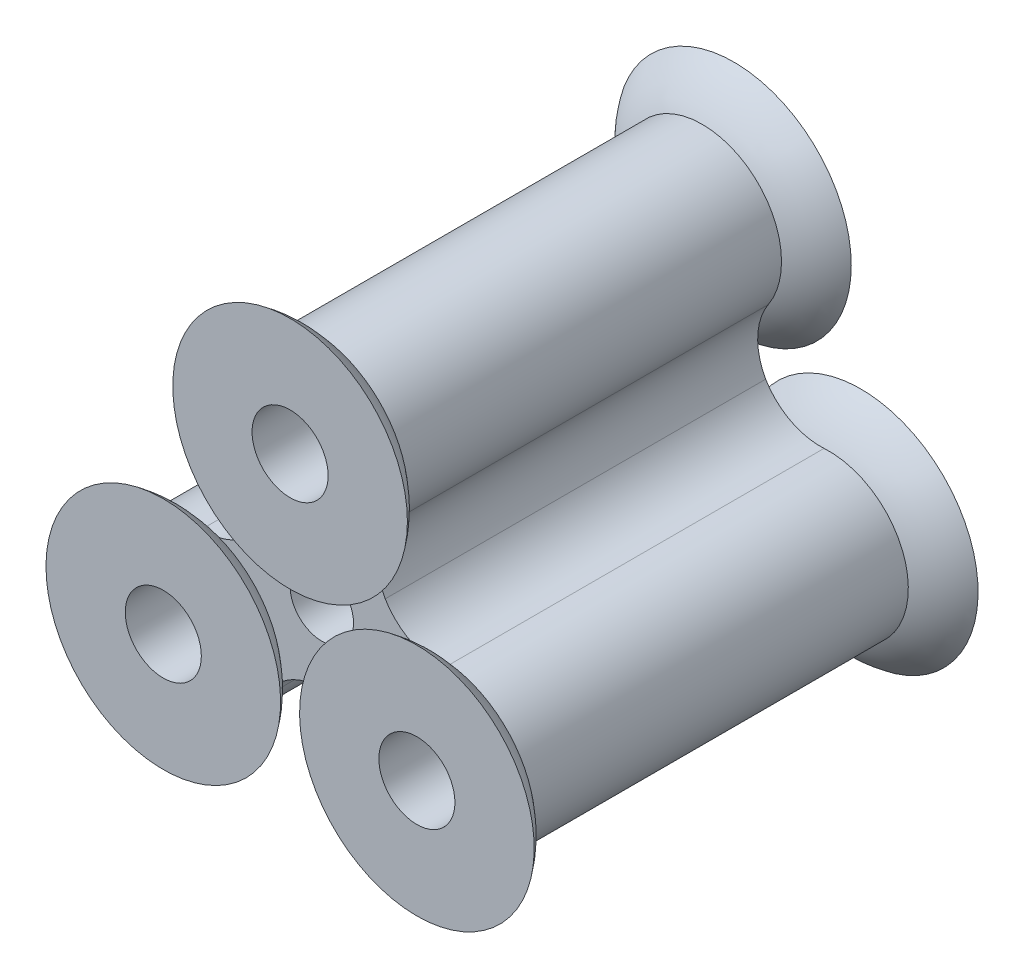
from build123d import *
from build123d.topology import SkipClean

# Parameters (mm, degrees)
SKETCH1_R           = 6
SKETCH1_R_2         = 5
BOSS_EXTRUDE1_DEPTH = 60
FILLET1_R           = 10
FILLET2_R           = 9
CIRPATTERN1_COUNT   = 3


with BuildPart() as part:
    # Sketch1 → Boss-Extrude1 (new body)
    with BuildSketch(Plane.XY):
        with BuildLine():
            ThreePointArc((7.496526573, -11.545), (30.821844121, -17.795), (13.746526573, -0.719682453))
            Line((13.746526573, -0.719682453), (6.25, 12.264682453))
            ThreePointArc((6.25, 12.264682453), (0, 35.59), (-6.25, 12.264682453))
            Line((-6.25, 12.264682453), (-13.746526573, -0.719682453))
            ThreePointArc((-13.746526573, -0.719682453), (-30.821844121, -17.795), (-7.496526573, -11.545))
            Line((-7.496526573, -11.545), (7.496526573, -11.545))
        make_face()
        with Locations((19.996526573, -11.545)):
            Circle(SKETCH1_R, mode=Mode.SUBTRACT)
        with Locations((0, 23.09)):
            Circle(SKETCH1_R, mode=Mode.SUBTRACT)
        Circle(SKETCH1_R_2, mode=Mode.SUBTRACT)
        with Locations((-19.996526573, -11.545)):
            Circle(SKETCH1_R, mode=Mode.SUBTRACT)
    extrude(amount=BOSS_EXTRUDE1_DEPTH)

    # Fillet1
    # the kernel refuses this fillet: 10 mm, written as the material it adds along each edge
    with BuildSketch(Plane(origin=(13.746526573, -0.719682453, 0), x_dir=(0.9572887202141619, 0.28913371673108657, 0), z_dir=(0, 0, 1))) as fillet1_piece_1:
        with BuildLine():
            CenterArc((7.988652571, 9.736032088), FILLET1_R, 193.193899981, 63.612200039)
            Line((-1.747379517, 7.453559925), (0, 0))
            ThreePointArc((0, 0), (2.853090204, 0.32995989), (5.706180408, 0))
        make_face()
    extrude(amount=60)
    with BuildSketch(Plane(origin=(6.25, 12.264682453, 0), x_dir=(0.4999999999999975, -0.86602540378444, 0), z_dir=(0, 0, 1))) as fillet1_piece_2:
        with BuildLine():
            CenterArc((7.655644371, 10), FILLET1_R, 206.387799961, 63.612200039)
            ThreePointArc((-1.302419794, 5.555555556), (-0.32995989, 2.853090204), (0, 0))
            Line((0, 0), (7.655644371, 0))
        make_face()
    extrude(amount=60)

    # Fillet2
    fillet2_edges = [part.edges().sort_by_distance(p)[0] for p in [
        (7.496526573, -11.545, 30),
        (-7.496526573, -11.545, 30),
        (-13.746526573, -0.719682453, 30),
        (-6.25, 12.264682453, 30),
    ]]
    fillet(fillet2_edges, radius=FILLET2_R)

    # Sketch2 → Revolve3 (revolve)
    with BuildSketch(Plane(origin=(0, 0, 0), x_dir=(0, 0, -1), z_dir=(1, 0, 0)), mode=Mode.PRIVATE) as revolve3_sk:
        with BuildLine():
            Line((-60, 35.59), (-60, 29.09))
            Line((-60, 29.09), (-65, 29.09))
            Line((-65, 29.09), (-65, 41.59))
            ThreePointArc((-65, 41.59), (-62.102636282, 38.921136432), (-60, 35.59))
        make_face()
    revolve3 = revolve(revolve3_sk.sketch.rotate(Axis((0, 23.09, 60), (0, 0, -1)), 90), axis=Axis((0, 23.09, 60), (0, 0, -1)))

    # CirPattern1: Revolve3 ×3 about axis
    with SkipClean():  # the faces are left unmerged after this step: merging them gives an invalid solid
        cirpattern1_axis = Axis((0, 0, 0), (0, 0, 1))
        for i in range(1, CIRPATTERN1_COUNT):
            add(revolve3.rotate(cirpattern1_axis, i * 360 / CIRPATTERN1_COUNT))

    # Mirror1: Revolve3 across plane
    with SkipClean():  # the faces are left unmerged after this step: merging them gives an invalid solid
        add(revolve3.mirror(Plane.XY.offset(30)))

    # Mirror1 copy 1 sketch → Mirror1 copy 1 (revolve)
    with SkipClean():  # the faces are left unmerged after this step: merging them gives an invalid solid
        with BuildSketch(Plane(origin=(0, 0, 60), x_dir=(0, 0, 1), z_dir=(-0.4999999999999998, 0.8660254037844387, 0))):
            with BuildLine():
                Line((-60, -35.59), (-60, -29.09))
                Line((-60, -29.09), (-65, -29.09))
                Line((-65, -29.09), (-65, -41.59))
                ThreePointArc((-65, -41.59), (-62.102636282, -38.921136432), (-60, -35.59))
            make_face()
        revolve(axis=Axis((-19.996526573, -11.545, 0), (0, 0, -1)))

    # Mirror1 copy 2 sketch → Mirror1 copy 2 (revolve)
    with SkipClean():  # the faces are left unmerged after this step: merging them gives an invalid solid
        with BuildSketch(Plane(origin=(0, 0, 60), x_dir=(0, 0, 1), z_dir=(-0.5000000000000004, -0.8660254037844384, 0))):
            with BuildLine():
                Line((-60, -35.59), (-60, -29.09))
                Line((-60, -29.09), (-65, -29.09))
                Line((-65, -29.09), (-65, -41.59))
                ThreePointArc((-65, -41.59), (-62.102636282, -38.921136432), (-60, -35.59))
            make_face()
        revolve(axis=Axis((19.996526573, -11.545, 0), (0, 0, -1)))


solid = part.part
